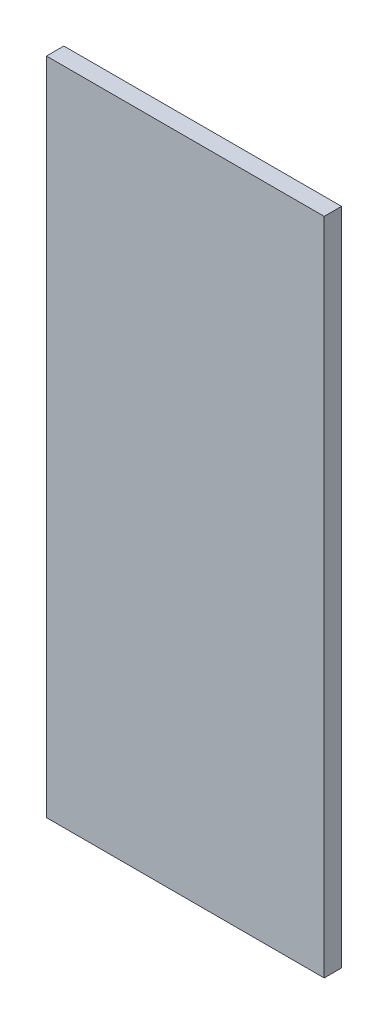
from build123d import *

# Parameters (mm, degrees)
SKETCH_2_W      = 160
SKETCH_2_H      = 380
EXTRUDE_1_DEPTH = 10


with BuildPart() as part:
    # Эскиз2 → Бобышка-Вытянуть1 (new body)
    with BuildSketch(Plane.XY):
        with Locations((80, 190)):
            Rectangle(SKETCH_2_W, SKETCH_2_H)
    extrude(amount=EXTRUDE_1_DEPTH)


solid = part.part
